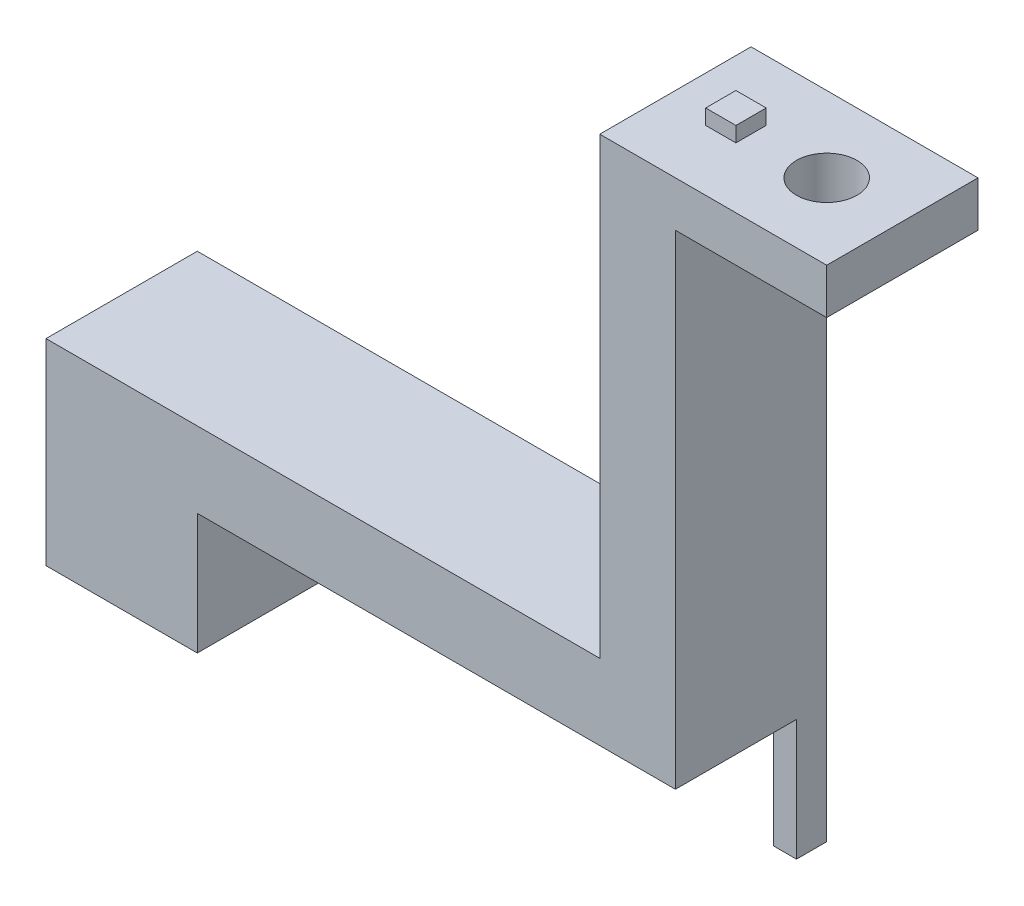
from build123d import *

# Parameters (mm, degrees)
BOSS_EXTRUDE1_DEPTH = 10
SKETCH2_W           = 5.1
SKETCH2_H           = 3.1
CUT_EXTRUDE1_DEPTH  = 10
SKETCH3_W           = 2
SKETCH3_H           = 2
BOSS_EXTRUDE2_DEPTH = 1
CUT_EXTRUDE4_REACH  = 69.908
SKETCH11_R          = 2
SKETCH12_W          = 1.5
SKETCH12_H          = 2
BOSS_EXTRUDE4_DEPTH = 8


with BuildPart() as part:
    # Sketch1 → Boss-Extrude1 (new body)
    with BuildSketch(Plane.XY):
        Polygon((10, 13), (36.6, 13), (36.6, 43), (51.6, 43), (51.6, 40), (41.6, 40), (41.6, 8), (10, 8), (10, 0), (0, 0), (0, 13), align=None)
    extrude(amount=BOSS_EXTRUDE1_DEPTH)

    # Sketch2 → Cut-Extrude1 (cut)
    with BuildSketch(Plane.XZ):
        with Locations((5, 5)):
            Rectangle(SKETCH2_W, SKETCH2_H)
    extrude(amount=-CUT_EXTRUDE1_DEPTH, mode=Mode.SUBTRACT)

    # Sketch3 → Boss-Extrude2 (add)
    with BuildSketch(Plane(origin=(0, 43, 0), x_dir=(1, 0, 0), z_dir=(0, 1, 0))):
        with Locations((40.6, -5)):
            Rectangle(SKETCH3_W, SKETCH3_H)
    extrude(amount=BOSS_EXTRUDE2_DEPTH)

    # Sketch11 → Cut-Extrude4 (cut, up to next)
    with BuildSketch(Plane(origin=(0, 43, 0), x_dir=(1, 0, 0), z_dir=(0, 1, 0)), mode=Mode.PRIVATE) as cut_extrude4_sk1:
        with Locations((46.6, -5)):
            Circle(SKETCH11_R)
    cut_extrude4_tool1 = extrude(cut_extrude4_sk1.sketch, amount=-CUT_EXTRUDE4_REACH, mode=Mode.PRIVATE) & part.part
    add(cut_extrude4_tool1.solids().sort_by_distance((46.6, 43, 5))[0], mode=Mode.SUBTRACT)

    # Sketch12 → Boss-Extrude4 (add)
    with BuildSketch(Plane.XZ.offset(-8)):
        with Locations((40.85, 1)):
            Rectangle(SKETCH12_W, SKETCH12_H)
    extrude(amount=BOSS_EXTRUDE4_DEPTH)


solid = part.part
